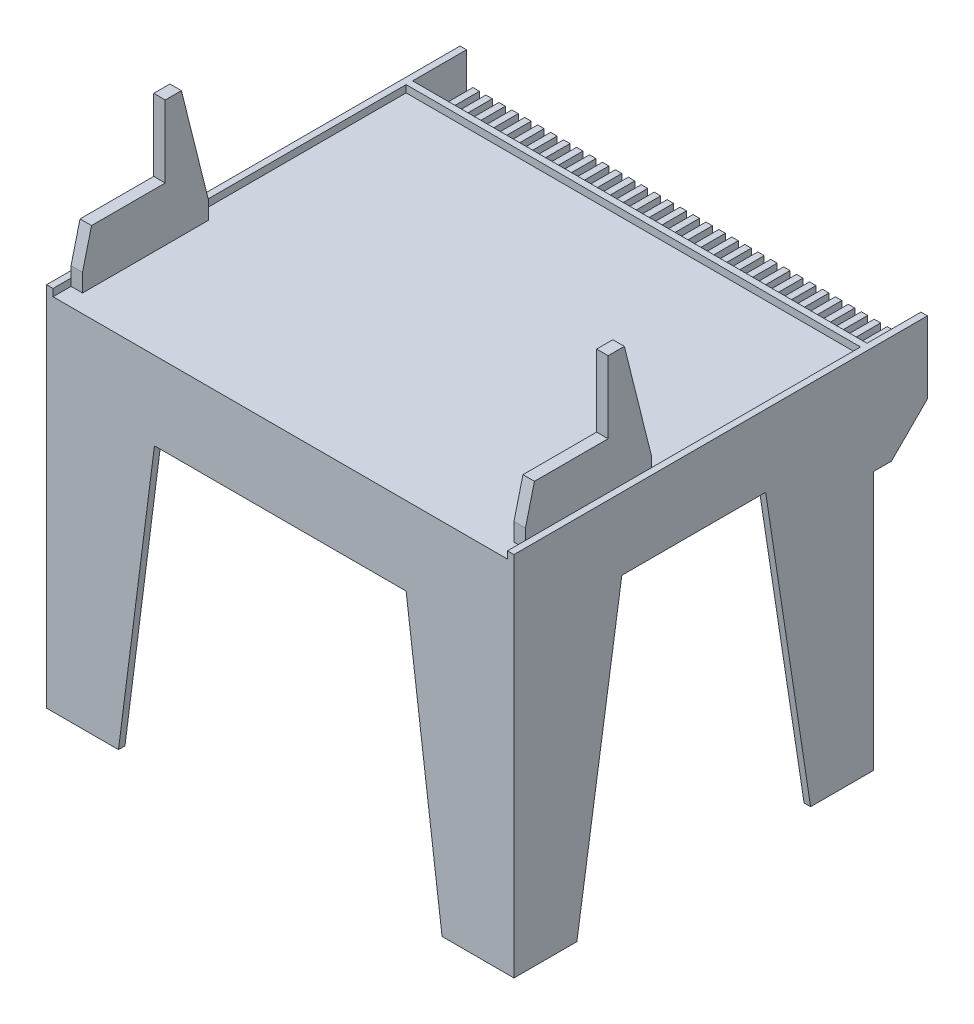
from build123d import *

# Parameters (mm, degrees)
EXTRUIR_L_MINA1_DEPTH       = 1020
SALIENTE_EXTRUIR1_START     = 1000
CROQUIS2_W                  = 1300
CROQUIS2_H                  = 1000
SALIENTE_EXTRUIR1_DEPTH     = 18
SALIENTE_EXTRUIR2_OUTLINE_W = 32
SALIENTE_EXTRUIR2_OUTLINE_H = 350
SALIENTE_EXTRUIR2_DEPTH     = 350
CORTAR_EXTRUIR1_DEPTH       = 1940.716474127
CORTAR_EXTRUIR2_DEPTH       = 1940.716474127
EXTRUIR_L_MINA3_DEPTH       = 150
SALIENTE_EXTRUIR3_DEPTH     = 18
CROQUIS9_W                  = 18
CROQUIS9_H                  = 150
SALIENTE_EXTRUIR4_DEPTH     = 50
MATRIZL1_COUNT              = 34
MATRIZL1_PITCH              = 36
CORTAR_EXTRUIR3_DEPTH       = 1984.683442488
CORTAR_EXTRUIR4_DEPTH       = 1802.388353465
SALIENTE_EXTRUIR5_DEPTH     = 18


# Read off the part's stored shape, not the designer's step: Saliente-Extruir2
with BuildPart() as part:
    # Croquis1 → Extruir-Lámina1 (new body)
    with BuildSketch(Plane(origin=(0, 0, 0), x_dir=(1, 0, 0), z_dir=(0, 1, 0))):
        Polygon((-650, -500), (-650, 500), (650, 500), (650, -500), (632, -500), (632, 482), (-632, 482), (-632, -500), align=None)
    extrude(amount=EXTRUIR_L_MINA1_DEPTH)

    # Croquis2 → Saliente-Extruir1 (add)
    with BuildSketch(Plane(origin=(0, 0, 0), x_dir=(1, 0, 0), z_dir=(0, 1, 0)).offset(SALIENTE_EXTRUIR1_START)):
        Rectangle(CROQUIS2_W, CROQUIS2_H)
    extrude(amount=-SALIENTE_EXTRUIR1_DEPTH)

    # Saliente-Extruir2 outline → Saliente-Extruir2 (add)
    with BuildSketch(Plane(origin=(0, 1000, 0), x_dir=(1, 0, 0), z_dir=(0, 1, 0))):
        with Locations((-616, -275)):
            Rectangle(SALIENTE_EXTRUIR2_OUTLINE_W, SALIENTE_EXTRUIR2_OUTLINE_H)
        with Locations((616, -275)):
            Rectangle(SALIENTE_EXTRUIR2_OUTLINE_W, SALIENTE_EXTRUIR2_OUTLINE_H)
    extrude(amount=SALIENTE_EXTRUIR2_DEPTH)

    # Croquis5 → Cortar-Extruir1 (cut, through all)
    with BuildSketch(Plane(origin=(650, 0, 0), x_dir=(0, 0, -1), z_dir=(1, 0, 0))):
        Polygon((-175, 1350), (-100, 1050), (-100, 1350), align=None)
        Polygon((-450, 1350), (-375, 1350), (-450, 1050), align=None)
    extrude(amount=-CORTAR_EXTRUIR1_DEPTH, mode=Mode.SUBTRACT)

    # Croquis6 → Cortar-Extruir2 (cut, through all)
    with BuildSketch(Plane(origin=(650, 0, 0), x_dir=(0, 0, -1), z_dir=(1, 0, 0))):
        Polygon((-330, 1150), (-220, 1150), (-220, 1400), (-330, 1400), (-437.5, 1400), (-437.5, 1150), align=None)
    extrude(amount=-CORTAR_EXTRUIR2_DEPTH, mode=Mode.SUBTRACT)

    # Croquis7 → Extruir-Lámina3 (add)
    with BuildSketch(Plane(origin=(0, 0, -500), x_dir=(-1, 0, 0), z_dir=(0, 0, -1))):
        Polygon((-650, 1020), (-650, 870), (650, 870), (650, 1020), (632, 1020), (632, 888), (-632, 888), (-632, 1020), align=None)
    extrude(amount=EXTRUIR_L_MINA3_DEPTH)

    # Croquis8 → Saliente-Extruir3 (add)
    with BuildSketch(Plane(origin=(650, 0, 0), x_dir=(0, 0, -1), z_dir=(1, 0, 0))):
        Polygon((500, 870), (650, 870), (650, 820), (550, 720), (500, 720), align=None)
    saliente_extruir3 = extrude(amount=-SALIENTE_EXTRUIR3_DEPTH)

    # Simetría1: Saliente-Extruir3 across plane
    add(saliente_extruir3.mirror(Plane(origin=(0, 0, 0), x_dir=(0, 0, 1), z_dir=(1, 0, 0))))

    # Croquis9 → Saliente-Extruir4 (add)
    with BuildSketch(Plane(origin=(0, 888, 0), x_dir=(1, 0, 0), z_dir=(0, 1, 0))):
        with Locations((-605, 575)):
            Rectangle(CROQUIS9_W, CROQUIS9_H)
    saliente_extruir4 = extrude(amount=SALIENTE_EXTRUIR4_DEPTH)

    # MatrizL1: Saliente-Extruir4 ×34
    with Locations(*[(i * MATRIZL1_PITCH, 0, 0) for i in range(1, MATRIZL1_COUNT)]):
        add(saliente_extruir4)

    # Croquis10 → Cortar-Extruir3 (cut, through all)
    with BuildSketch(Plane.ZY.offset(650)):
        Polygon((325, 0), (200, 820), (-200, 820), (-325, 0), align=None)
    extrude(amount=-CORTAR_EXTRUIR3_DEPTH, mode=Mode.SUBTRACT)

    # Croquis11 → Cortar-Extruir4 (cut, through all)
    with BuildSketch(Plane(origin=(0, 0, -500), x_dir=(-1, 0, 0), z_dir=(0, 0, -1))):
        Polygon((-450, 0), (450, 0), (350, 782), (-350, 782), align=None)
    extrude(amount=-CORTAR_EXTRUIR4_DEPTH, mode=Mode.SUBTRACT)

    # Croquis12 → Saliente-Extruir5 (add)
    with BuildSketch(Plane.XY.offset(500)):
        Polygon((-350, 782), (-632, 782), (-632, 0), (-450, 0), align=None)
        Polygon((632, 982), (-632, 982), (-632, 782), (-350, 782), (350, 782), (632, 782), align=None)
        Polygon((632, 0), (632, 782), (350, 782), (450, 0), align=None)
    extrude(amount=-SALIENTE_EXTRUIR5_DEPTH)


solid = part.part
